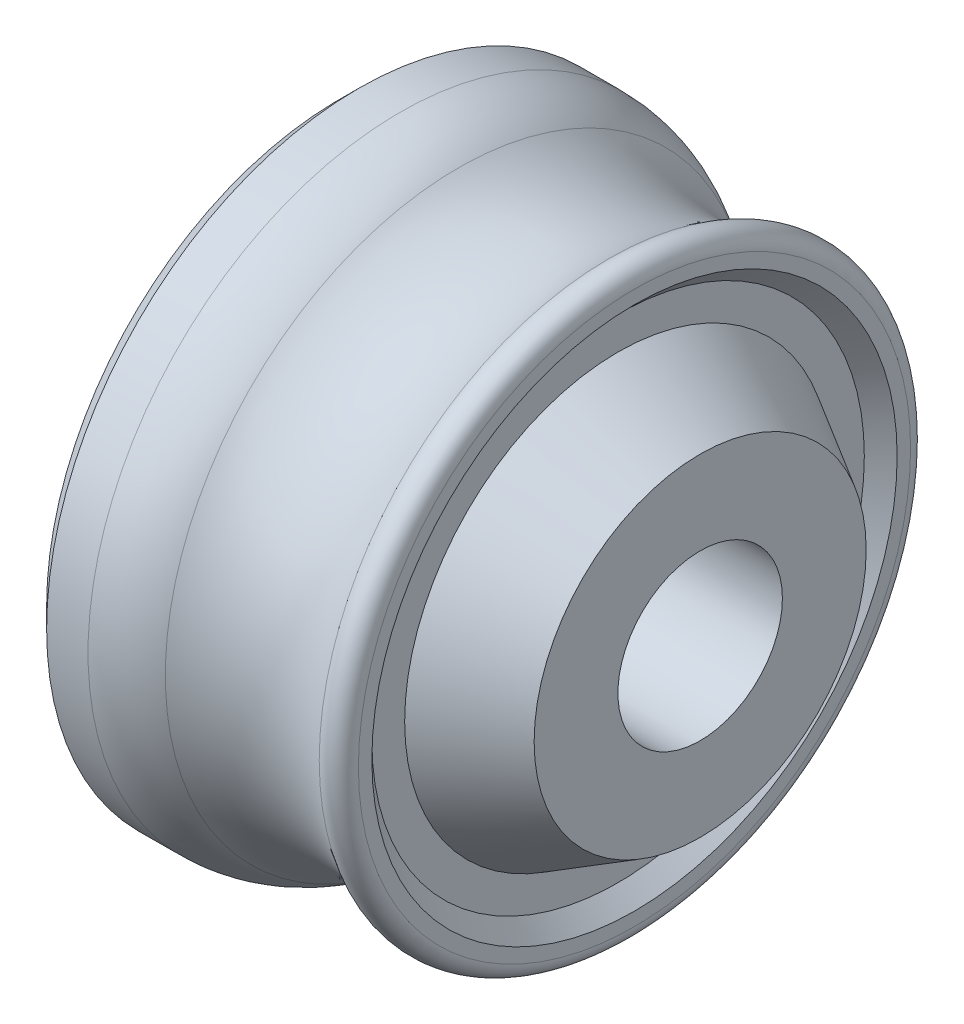
from build123d import *

# Parameters (mm, degrees)
SKETCH2_R           = 7
SKETCH2_R_2         = 4.5
CUT_EXTRUDE1_DEPTH  = 0.5
CHAMFER3_SIZE       = 1
BOSS_EXTRUDE1_START = 2
SKETCH3_R           = 4.5
SKETCH3_R_2         = 2.505
BOSS_EXTRUDE1_DEPTH = 2
CHAMFER4_SIZE       = 2
CHAMFER4_SIZE_2     = 3.464101615
SKETCH4_R           = 9.505
SKETCH4_R_2         = 2.505
BOSS_EXTRUDE2_DEPTH = 3
FILLET1_R           = 0.5
FILLET2_R           = 3
CHAMFER5_SIZE       = 0.6


with BuildPart() as part:
    # Sketch1 → Revolve1 (revolve)
    with BuildSketch(Plane.XY, mode=Mode.PRIVATE) as revolve1_sk:
        with BuildLine():
            Line((-3, -9.505), (-3, -2.505))
            Line((-3, -2.505), (3, -2.505))
            Line((3, -2.505), (3, -9.505))
            ThreePointArc((3, -9.505), (0, -8.150751311), (-3, -9.505))
        make_face()
    revolve(revolve1_sk.sketch.rotate(Axis((0, 0, 0), (-1, 0, 0)), 270), axis=Axis((0, 0, 0), (-1, 0, 0)))

    # Sketch2 → Cut-Extrude1 (cut)
    with BuildSketch(Plane(origin=(3, 0, 0), x_dir=(0, 0, -1), z_dir=(1, 0, 0))):
        Circle(SKETCH2_R)
        Circle(SKETCH2_R_2, mode=Mode.SUBTRACT)
    extrude(amount=-CUT_EXTRUDE1_DEPTH, mode=Mode.SUBTRACT)

    # Chamfer3
    # the kernel refuses this chamfer: 1 mm, written as the material it takes off along each edge
    with BuildSketch(Plane(origin=(3, 0, 0), x_dir=(0, 0, -1), z_dir=(0, -1, 0))) as chamfer3_piece_1_section:
        Polygon((7 + CHAMFER3_SIZE, 0), (7, -CHAMFER3_SIZE), (7, 0), align=None)
    chamfer3_piece_1 = revolve(axis=Axis((3, 0, 0), (1, 0, 0)), mode=Mode.PRIVATE)
    chamfer3_piece_1 = split(chamfer3_piece_1, bisect_by=Plane(origin=(2.5, 0, 7.745273701), z_dir=(1, 0, 0)), keep=Keep.TOP, mode=Mode.PRIVATE)
    add(chamfer3_piece_1, mode=Mode.SUBTRACT)

    # Sketch3 → Boss-Extrude1 (add)
    with BuildSketch(Plane(origin=(3, 0, 0), x_dir=(0, 0, -1), z_dir=(1, 0, 0)).offset(BOSS_EXTRUDE1_START)):
        Circle(SKETCH3_R)
        Circle(SKETCH3_R_2, mode=Mode.SUBTRACT)
    extrude(amount=-BOSS_EXTRUDE1_DEPTH)

    # Chamfer4
    # the kernel refuses this chamfer: 3.464101615, 2 mm, written as the material it adds along each edge
    with BuildSketch(Plane(origin=(2.5, 0, 0), x_dir=(0, 0, -1), z_dir=(0, -1, 0))) as chamfer4_piece_1_section:
        Polygon((4.5 + CHAMFER4_SIZE, 0), (4.5, CHAMFER4_SIZE_2), (4.5, 0), align=None)
    chamfer4_piece_1 = revolve(axis=Axis((2.5, 0, 0), (1, 0, 0)), mode=Mode.PRIVATE)
    chamfer4_piece_1 = split(chamfer4_piece_1, bisect_by=Plane(origin=(5, 0, 5.770731059), z_dir=(-1, 0, 0)), keep=Keep.TOP, mode=Mode.PRIVATE)
    add(chamfer4_piece_1)

    # Sketch4 → Boss-Extrude2 (add)
    with BuildSketch(Plane.ZY.offset(3)):
        Circle(SKETCH4_R)
        with Locations(Location((0, 0, 0), (0, 0, 180))):
            Circle(SKETCH4_R_2, mode=Mode.SUBTRACT)
    extrude(amount=BOSS_EXTRUDE2_DEPTH)

    # Fillet1
    fillet1_edges = [part.edges().sort_by_distance(p)[0] for p in [
        (3, 0, 9.505),
    ]]
    fillet(fillet1_edges, radius=FILLET1_R)

    # Fillet2
    fillet2_edges = [part.edges().sort_by_distance(p)[0] for p in [
        (-3, -9.505, 0),
    ]]
    fillet(fillet2_edges, radius=FILLET2_R)

    # Chamfer5
    chamfer5_edges = [part.edges().sort_by_distance(p)[0] for p in [
        (-6, 0, -9.505),
        (-6, 0, 2.505),
    ]]
    chamfer(chamfer5_edges, length=CHAMFER5_SIZE)


solid = part.part
